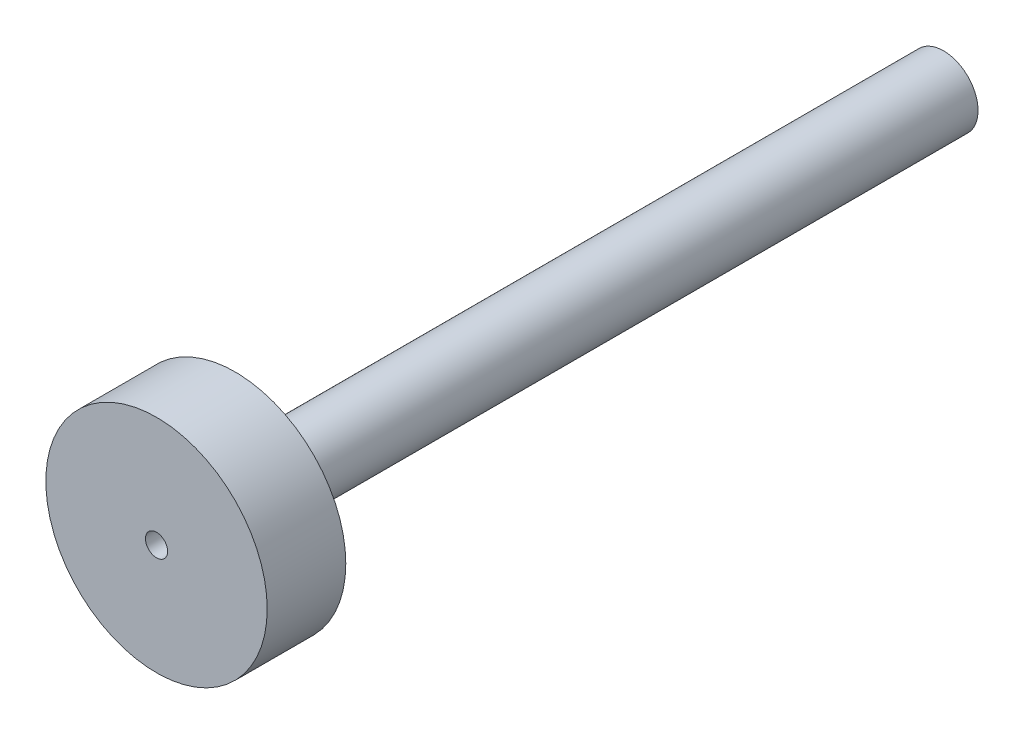
from build123d import *

# Parameters (mm, degrees)
SKETCH1_R           = 12.5
BOSS_EXTRUDE1_DEPTH = 8.875
SKETCH2_R           = 3.9
BOSS_EXTRUDE2_DEPTH = 80
SKETCH3_R           = 1.25
CUT_EXTRUDE1_DEPTH  = 3


with BuildPart() as part:
    # Sketch1 → Boss-Extrude1 (new body)
    with BuildSketch(Plane.XY):
        Circle(SKETCH1_R)
    extrude(amount=BOSS_EXTRUDE1_DEPTH)

    # Sketch2 → Boss-Extrude2 (add)
    with BuildSketch(Plane(origin=(0, 0, 0), x_dir=(-1, 0, 0), z_dir=(0, 0, -1))):
        Circle(SKETCH2_R)
    extrude(amount=BOSS_EXTRUDE2_DEPTH)

    # Sketch3 → Cut-Extrude1 (cut)
    with BuildSketch(Plane.XY.offset(8.875)):
        Circle(SKETCH3_R)
    extrude(amount=-CUT_EXTRUDE1_DEPTH, mode=Mode.SUBTRACT)


solid = part.part
